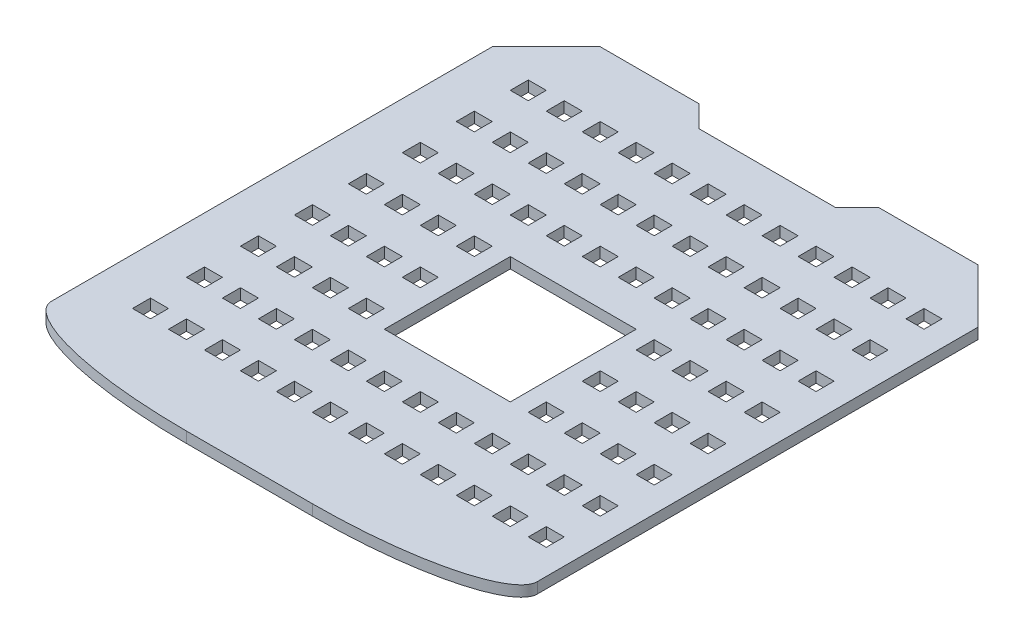
from build123d import *

# Parameters (mm, degrees)
SKETCH1_W           = 135
SKETCH1_H           = 150
BOSS_EXTRUDE1_DEPTH = 3
SKETCH2_W           = 5
SKETCH2_H           = 5
CUT_EXTRUDE1_DEPTH  = 101.94676815
FILLET1_SIZE        = 12.5
FILLET1_SIZE_2      = 50
FILLET2_SIZE        = 12.5
FILLET2_SIZE_2      = 50
CUT_EXTRUDE2_DEPTH  = 101.946768294
CUT_EXTRUDE3_DEPTH  = 101.946768294
SKETCH6_W           = 35
SKETCH6_H           = 35
CUT_EXTRUDE4_DEPTH  = 101.946768294


with BuildPart() as part:
    # Sketch1 → Boss-Extrude1 (new body)
    with BuildSketch(Plane(origin=(0, 0, 0), x_dir=(1, 0, 0), z_dir=(0, 1, 0))):
        Rectangle(SKETCH1_W, SKETCH1_H)
    extrude(amount=BOSS_EXTRUDE1_DEPTH)

    # Sketch2 → Cut-Extrude1 (cut, through all)
    with BuildSketch(Plane(origin=(0, 3, 0), x_dir=(1, 0, 0), z_dir=(0, 1, 0))):
        with Locations((-42, -50.5)):
            Rectangle(SKETCH2_W, SKETCH2_H)
        with Locations((-52, -50.5)):
            Rectangle(SKETCH2_W, SKETCH2_H)
        with Locations((-32, -50.5)):
            Rectangle(SKETCH2_W, SKETCH2_H)
        with Locations((-22, -50.5)):
            Rectangle(SKETCH2_W, SKETCH2_H)
        with Locations((-12, -50.5)):
            Rectangle(SKETCH2_W, SKETCH2_H)
        with Locations((-2, -50.5)):
            Rectangle(SKETCH2_W, SKETCH2_H)
        with Locations((8, -50.5)):
            Rectangle(SKETCH2_W, SKETCH2_H)
        with Locations((18, -50.5)):
            Rectangle(SKETCH2_W, SKETCH2_H)
        with Locations((28, -50.5)):
            Rectangle(SKETCH2_W, SKETCH2_H)
        with Locations((38, -50.5)):
            Rectangle(SKETCH2_W, SKETCH2_H)
        with Locations((48, -50.5)):
            Rectangle(SKETCH2_W, SKETCH2_H)
        with Locations((58, -50.5)):
            Rectangle(SKETCH2_W, SKETCH2_H)
        with Locations((-42, -35.5)):
            Rectangle(SKETCH2_W, SKETCH2_H)
        with Locations((-32, -35.5)):
            Rectangle(SKETCH2_W, SKETCH2_H)
        with Locations((-22, -35.5)):
            Rectangle(SKETCH2_W, SKETCH2_H)
        with Locations((-12, -35.5)):
            Rectangle(SKETCH2_W, SKETCH2_H)
        with Locations((-2, -35.5)):
            Rectangle(SKETCH2_W, SKETCH2_H)
        with Locations((8, -35.5)):
            Rectangle(SKETCH2_W, SKETCH2_H)
        with Locations((18, -35.5)):
            Rectangle(SKETCH2_W, SKETCH2_H)
        with Locations((28, -35.5)):
            Rectangle(SKETCH2_W, SKETCH2_H)
        with Locations((38, -35.5)):
            Rectangle(SKETCH2_W, SKETCH2_H)
        with Locations((48, -35.5)):
            Rectangle(SKETCH2_W, SKETCH2_H)
        with Locations((58, -35.5)):
            Rectangle(SKETCH2_W, SKETCH2_H)
        with Locations((-42, -20.5)):
            Rectangle(SKETCH2_W, SKETCH2_H)
        with Locations((-32, -20.5)):
            Rectangle(SKETCH2_W, SKETCH2_H)
        with Locations((-22, -20.5)):
            Rectangle(SKETCH2_W, SKETCH2_H)
        with Locations((-12, -20.5)):
            Rectangle(SKETCH2_W, SKETCH2_H)
        with Locations((-2, -20.5)):
            Rectangle(SKETCH2_W, SKETCH2_H)
        with Locations((8, -20.5)):
            Rectangle(SKETCH2_W, SKETCH2_H)
        with Locations((18, -20.5)):
            Rectangle(SKETCH2_W, SKETCH2_H)
        with Locations((28, -20.5)):
            Rectangle(SKETCH2_W, SKETCH2_H)
        with Locations((38, -20.5)):
            Rectangle(SKETCH2_W, SKETCH2_H)
        with Locations((48, -20.5)):
            Rectangle(SKETCH2_W, SKETCH2_H)
        with Locations((58, -20.5)):
            Rectangle(SKETCH2_W, SKETCH2_H)
        with Locations((-42, -5.5)):
            Rectangle(SKETCH2_W, SKETCH2_H)
        with Locations((-32, -5.5)):
            Rectangle(SKETCH2_W, SKETCH2_H)
        with Locations((-22, -5.5)):
            Rectangle(SKETCH2_W, SKETCH2_H)
        with Locations((-12, -5.5)):
            Rectangle(SKETCH2_W, SKETCH2_H)
        with Locations((-2, -5.5)):
            Rectangle(SKETCH2_W, SKETCH2_H)
        with Locations((8, -5.5)):
            Rectangle(SKETCH2_W, SKETCH2_H)
        with Locations((18, -5.5)):
            Rectangle(SKETCH2_W, SKETCH2_H)
        with Locations((28, -5.5)):
            Rectangle(SKETCH2_W, SKETCH2_H)
        with Locations((38, -5.5)):
            Rectangle(SKETCH2_W, SKETCH2_H)
        with Locations((48, -5.5)):
            Rectangle(SKETCH2_W, SKETCH2_H)
        with Locations((58, -5.5)):
            Rectangle(SKETCH2_W, SKETCH2_H)
        with Locations((-42, 9.5)):
            Rectangle(SKETCH2_W, SKETCH2_H)
        with Locations((-32, 9.5)):
            Rectangle(SKETCH2_W, SKETCH2_H)
        with Locations((-22, 9.5)):
            Rectangle(SKETCH2_W, SKETCH2_H)
        with Locations((-12, 9.5)):
            Rectangle(SKETCH2_W, SKETCH2_H)
        with Locations((-2, 9.5)):
            Rectangle(SKETCH2_W, SKETCH2_H)
        with Locations((8, 9.5)):
            Rectangle(SKETCH2_W, SKETCH2_H)
        with Locations((18, 9.5)):
            Rectangle(SKETCH2_W, SKETCH2_H)
        with Locations((28, 9.5)):
            Rectangle(SKETCH2_W, SKETCH2_H)
        with Locations((38, 9.5)):
            Rectangle(SKETCH2_W, SKETCH2_H)
        with Locations((48, 9.5)):
            Rectangle(SKETCH2_W, SKETCH2_H)
        with Locations((58, 9.5)):
            Rectangle(SKETCH2_W, SKETCH2_H)
        with Locations((-42, 24.5)):
            Rectangle(SKETCH2_W, SKETCH2_H)
        with Locations((-32, 24.5)):
            Rectangle(SKETCH2_W, SKETCH2_H)
        with Locations((-22, 24.5)):
            Rectangle(SKETCH2_W, SKETCH2_H)
        with Locations((-12, 24.5)):
            Rectangle(SKETCH2_W, SKETCH2_H)
        with Locations((-2, 24.5)):
            Rectangle(SKETCH2_W, SKETCH2_H)
        with Locations((8, 24.5)):
            Rectangle(SKETCH2_W, SKETCH2_H)
        with Locations((18, 24.5)):
            Rectangle(SKETCH2_W, SKETCH2_H)
        with Locations((28, 24.5)):
            Rectangle(SKETCH2_W, SKETCH2_H)
        with Locations((38, 24.5)):
            Rectangle(SKETCH2_W, SKETCH2_H)
        with Locations((48, 24.5)):
            Rectangle(SKETCH2_W, SKETCH2_H)
        with Locations((58, 24.5)):
            Rectangle(SKETCH2_W, SKETCH2_H)
        with Locations((-42, 39.5)):
            Rectangle(SKETCH2_W, SKETCH2_H)
        with Locations((-32, 39.5)):
            Rectangle(SKETCH2_W, SKETCH2_H)
        with Locations((-22, 39.5)):
            Rectangle(SKETCH2_W, SKETCH2_H)
        with Locations((-12, 39.5)):
            Rectangle(SKETCH2_W, SKETCH2_H)
        with Locations((-2, 39.5)):
            Rectangle(SKETCH2_W, SKETCH2_H)
        with Locations((8, 39.5)):
            Rectangle(SKETCH2_W, SKETCH2_H)
        with Locations((18, 39.5)):
            Rectangle(SKETCH2_W, SKETCH2_H)
        with Locations((28, 39.5)):
            Rectangle(SKETCH2_W, SKETCH2_H)
        with Locations((38, 39.5)):
            Rectangle(SKETCH2_W, SKETCH2_H)
        with Locations((48, 39.5)):
            Rectangle(SKETCH2_W, SKETCH2_H)
        with Locations((58, 39.5)):
            Rectangle(SKETCH2_W, SKETCH2_H)
        with Locations((-42, 54.5)):
            Rectangle(SKETCH2_W, SKETCH2_H)
        with Locations((-32, 54.5)):
            Rectangle(SKETCH2_W, SKETCH2_H)
        with Locations((-22, 54.5)):
            Rectangle(SKETCH2_W, SKETCH2_H)
        with Locations((-12, 54.5)):
            Rectangle(SKETCH2_W, SKETCH2_H)
        with Locations((-2, 54.5)):
            Rectangle(SKETCH2_W, SKETCH2_H)
        with Locations((8, 54.5)):
            Rectangle(SKETCH2_W, SKETCH2_H)
        with Locations((18, 54.5)):
            Rectangle(SKETCH2_W, SKETCH2_H)
        with Locations((28, 54.5)):
            Rectangle(SKETCH2_W, SKETCH2_H)
        with Locations((38, 54.5)):
            Rectangle(SKETCH2_W, SKETCH2_H)
        with Locations((48, 54.5)):
            Rectangle(SKETCH2_W, SKETCH2_H)
        with Locations((58, 54.5)):
            Rectangle(SKETCH2_W, SKETCH2_H)
        with Locations((-52, -35.5)):
            Rectangle(SKETCH2_W, SKETCH2_H)
        with Locations((-52, -20.5)):
            Rectangle(SKETCH2_W, SKETCH2_H)
        with Locations((-52, -5.5)):
            Rectangle(SKETCH2_W, SKETCH2_H)
        with Locations((-52, 9.5)):
            Rectangle(SKETCH2_W, SKETCH2_H)
        with Locations((-52, 24.5)):
            Rectangle(SKETCH2_W, SKETCH2_H)
        with Locations((-52, 39.5)):
            Rectangle(SKETCH2_W, SKETCH2_H)
        with Locations((-52, 54.5)):
            Rectangle(SKETCH2_W, SKETCH2_H)
    extrude(amount=-CUT_EXTRUDE1_DEPTH, mode=Mode.SUBTRACT)

    # Fillet1
    # an asymmetric fillet: 50, 12.5 mm, written as the material it takes off along each edge
    with BuildSketch(Plane(origin=(-67.5, -125, 75), x_dir=(0, 0, -1), z_dir=(0, 1, 0))) as fillet1_piece_1:
        with BuildLine():
            Bezier((FILLET1_SIZE, 0), (0, 0), (0, -FILLET1_SIZE_2), weights=[1, 0.707106781, 1])
            Line((0, -FILLET1_SIZE_2), (0, 0))
            Line((0, 0), (FILLET1_SIZE, 0))
        make_face()
    extrude(amount=253, mode=Mode.SUBTRACT)

    # Fillet2
    # an asymmetric fillet: 50, 12.5 mm, written as the material it takes off along each edge
    with BuildSketch(Plane(origin=(67.5, -125, 75), x_dir=(0, 0, -1), z_dir=(0, 1, 0))) as fillet2_piece_1:
        with BuildLine():
            Bezier((FILLET2_SIZE, 0), (0, 0), (0, FILLET2_SIZE_2), weights=[1, 0.707106781, 1])
            Line((0, FILLET2_SIZE_2), (0, 0))
            Line((0, 0), (FILLET2_SIZE, 0))
        make_face()
    extrude(amount=253, mode=Mode.SUBTRACT)

    # Sketch4 → Cut-Extrude2 (cut, through all)
    with BuildSketch(Plane(origin=(0, 3, 0), x_dir=(1, 0, 0), z_dir=(0, 1, 0))):
        Polygon((-67.5, 60), (-67.5, 75), (-52.5, 75), align=None)
        Polygon((67.5, 75), (52.5, 75), (67.5, 60), align=None)
    extrude(amount=-CUT_EXTRUDE2_DEPTH, mode=Mode.SUBTRACT)

    # Sketch5 → Cut-Extrude3 (cut, through all)
    with BuildSketch(Plane(origin=(0, 3, 0), x_dir=(1, 0, 0), z_dir=(0, 1, 0))):
        Polygon((-25, 75), (25, 75), (19, 69), (-19, 69), align=None)
    extrude(amount=-CUT_EXTRUDE3_DEPTH, mode=Mode.SUBTRACT)

    # Sketch6 → Cut-Extrude4 (cut, through all)
    with BuildSketch(Plane(origin=(0, 3, 0), x_dir=(1, 0, 0), z_dir=(0, 1, 0))):
        with Locations((3, -5.5)):
            Rectangle(SKETCH6_W, SKETCH6_H)
    extrude(amount=-CUT_EXTRUDE4_DEPTH, mode=Mode.SUBTRACT)


solid = part.part
